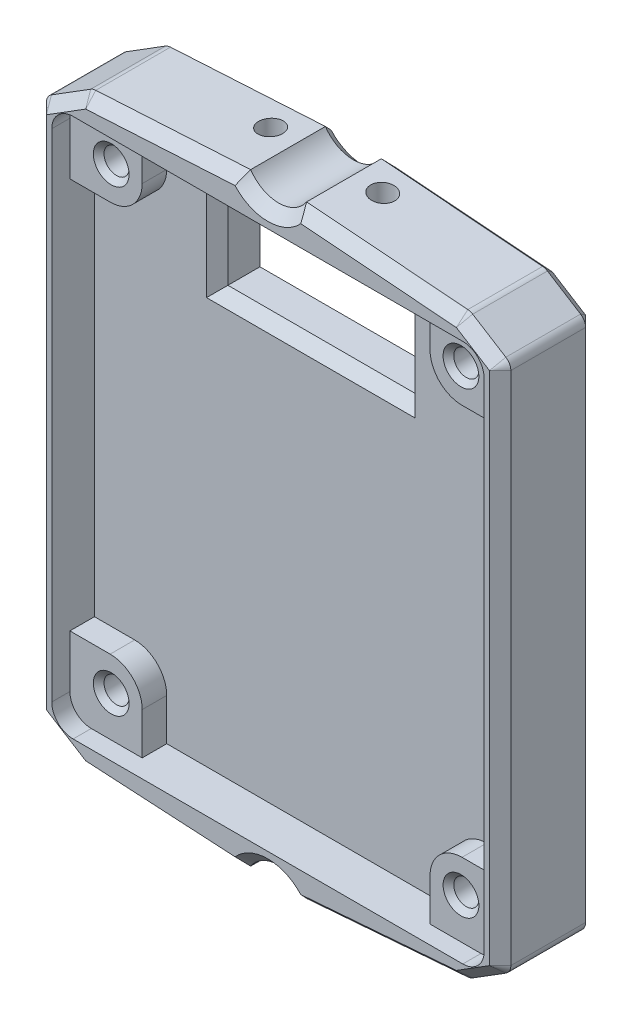
from build123d import *
from OCP.BRepFilletAPI import BRepFilletAPI_MakeChamfer

# Parameters (mm, degrees)
SKETCH1_W           = 46.5
SKETCH1_H           = 56.5
SKETCH1_W_2         = 40.5
SKETCH1_H_2         = 50.5
BOSS_EXTRUDE1_DEPTH = 4
SKETCH2_W           = 46.5
SKETCH2_H           = 56.5
BOSS_EXTRUDE2_DEPTH = 5
SKETCH3_W           = 6.769354508
SKETCH3_H           = 6.917814105
SKETCH3_R           = 1.175
BOSS_EXTRUDE3_DEPTH = 2.3
CHAMFER3_SIZE       = 4.5
CHAMFER3_SIZE2      = 7.201505381
FILLET1_R           = 3
SKETCH4_W           = 17.5
SKETCH4_H           = 10
CUT_EXTRUDE1_DEPTH  = 37.927293429
CUT_EXTRUDE2_DEPTH  = 38.677911301
SKETCH6_W           = 1.5
SKETCH6_H           = 60.377235873
CUT_EXTRUDE3_DEPTH  = 38.677911301
CUT_EXTRUDE4_START  = 30
SKETCH7_R           = 1.125
CUT_EXTRUDE4_DEPTH  = 10
FILLET2_R           = 1
CHAMFER1_SIZE       = 1
FILLET3_R           = 2
SKETCH8_R           = 1.175
CUT_EXTRUDE5_DEPTH  = 37.392706848
CUT_EXTRUDE6_DEPTH  = 1
CHAMFER2_SIZE       = 0.5
CHAMFER4_SIZE       = 1


# Some blends are built 0.0001 mm under size
with BuildPart() as part:
    # Sketch1 → Boss-Extrude1 (new body)
    with BuildSketch(Plane.XY):
        Rectangle(SKETCH1_W, SKETCH1_H)
        Rectangle(SKETCH1_W_2, SKETCH1_H_2, mode=Mode.SUBTRACT)
    extrude(amount=BOSS_EXTRUDE1_DEPTH)

    # Sketch2 → Boss-Extrude2 (add)
    with BuildSketch(Plane(origin=(0, 0, 0), x_dir=(-1, 0, 0), z_dir=(0, 0, -1))):
        Rectangle(SKETCH2_W, SKETCH2_H)
    extrude(amount=BOSS_EXTRUDE2_DEPTH)

    # Sketch3 → Boss-Extrude3 (add)
    # profile 1 of 4: a face of its own
    with BuildSketch(Plane.XY):
        with Locations((-16.865322746, 21.791092948)):
            Rectangle(SKETCH3_W, SKETCH3_H)
        with Locations((-16.38, 21.46)):
            Circle(SKETCH3_R, mode=Mode.SUBTRACT)
    # profile 2 of 4: a face of its own
    with BuildSketch(Plane.XY):
        with Locations((16.865322746, 21.791092948)):
            Rectangle(SKETCH3_W, SKETCH3_H)
        with Locations(Location((16.38, 21.46, 0), (0, 0, 180))):
            Circle(SKETCH3_R, mode=Mode.SUBTRACT)
    # profile 3 of 4: a face of its own
    with BuildSketch(Plane.XY):
        with Locations((16.865322746, -21.791092948)):
            Rectangle(SKETCH3_W, SKETCH3_H)
        with Locations((16.38, -21.46)):
            Circle(SKETCH3_R, mode=Mode.SUBTRACT)
    # profile 4 of 4: a face of its own
    with BuildSketch(Plane.XY):
        with Locations((-16.865322746, -21.791092948)):
            Rectangle(SKETCH3_W, SKETCH3_H)
        with Locations(Location((-16.38, -21.46, 0), (0, 0, 180))):
            Circle(SKETCH3_R, mode=Mode.SUBTRACT)
    extrude(amount=BOSS_EXTRUDE3_DEPTH)

    # Chamfer3: one chamfer whose edges measure the first distance from different faces: ONE call of the kernel's chamfer builder (chamfer() names one face for all edges)
    chamfer3_edges_1 = [part.edges().sort_by_distance(p)[0] for p in [
        (23.25, 28.25, -0.5),
        (23.25, -28.25, -0.5),
    ]]
    chamfer3_side_1 = [part.faces().sort_by_distance(p)[0] for p in [
        (23.25, 0, -0.5),
    ]]
    chamfer3_edges_2 = [part.edges().sort_by_distance(p)[0] for p in [
        (-23.25, -28.25, -0.5),
        (-23.25, 28.25, -0.5),
    ]]
    chamfer3_side_2 = [part.faces().sort_by_distance(p)[0] for p in [
        (-23.25, 0, -0.5),
    ]]
    chamfer3 = BRepFilletAPI_MakeChamfer(part.part.solid().wrapped)
    for e in chamfer3_edges_1:
        chamfer3.Add(CHAMFER3_SIZE, CHAMFER3_SIZE2, e.wrapped, chamfer3_side_1[0].wrapped)  # the first distance lies on this face
    for e in chamfer3_edges_2:
        chamfer3.Add(CHAMFER3_SIZE, CHAMFER3_SIZE2, e.wrapped, chamfer3_side_2[0].wrapped)  # the first distance lies on this face
    add(Compound.cast(chamfer3.Shape()), mode=Mode.REPLACE)

    # Fillet1
    fillet1_edges = [part.edges().sort_by_distance(p)[0] for p in [
        (-13.480645492, 18.332185895, 1.15),
        (13.480645492, 18.332185895, 1.15),
        (13.480645492, -18.332185895, 1.15),
        (-13.480645492, -18.332185895, 1.15),
    ]]
    fillet(fillet1_edges, radius=FILLET1_R)

    # Sketch4 → Cut-Extrude1 (cut, through all)
    with BuildSketch(Plane.XY):
        with Locations((0, 18.8)):
            Rectangle(SKETCH4_W, SKETCH4_H)
    extrude(amount=-CUT_EXTRUDE1_DEPTH, mode=Mode.SUBTRACT)

    # Sketch5 → Cut-Extrude2 (cut, through all)
    with BuildSketch(Plane(origin=(0, 0, -5), x_dir=(-1, 0, 0), z_dir=(0, 0, -1))):
        Polygon((-23.25, -26.637996363), (-23.25, -28.25), (-16.048494619, -28.25), (-17.967727773, -27.050730023), align=None)
        with BuildLine():
            ThreePointArc((2.619160171, -28.25), (0, -26.85), (-2.619160171, -28.25))
            Line((-2.619160171, -28.25), (2.619160171, -28.25))
        make_face()
        Polygon((17.383051154, -27.416076523), (16.048494619, -28.25), (23.25, -28.25), (23.25, -27.08468784), align=None)
        Polygon((-17.967727773, -27.050730023), (-16.048494619, -28.25), (-2.619160171, -28.25), align=None)
        Polygon((17.383051154, -27.416076523), (2.619160171, -28.25), (16.048494619, -28.25), align=None)
        Polygon((-17.967727773, 27.050730023), (-2.619160171, 28.25), (-16.048494619, 28.25), align=None)
        Polygon((16.048494619, 28.25), (2.619160171, 28.25), (17.383051154, 27.416076523), align=None)
        Polygon((16.048494619, 28.25), (17.383051154, 27.416076523), (23.25, 27.08468784), (23.25, 28.25), align=None)
        Polygon((-23.25, 26.637996363), (-17.967727773, 27.050730023), (-16.048494619, 28.25), (-23.25, 28.25), align=None)
        with BuildLine():
            Line((2.619160171, 28.25), (-2.619160171, 28.25))
            ThreePointArc((-2.619160171, 28.25), (0, 26.85), (2.619160171, 28.25))
        make_face()
    extrude(amount=-CUT_EXTRUDE2_DEPTH, mode=Mode.SUBTRACT)

    # Sketch6 → Cut-Extrude3 (cut, through all)
    with BuildSketch(Plane.XY.offset(4)):
        with Locations((-22.500324405, 3.019222435)):
            Rectangle(SKETCH6_W, SKETCH6_H)
        with Locations((22.500324405, 3.019222435)):
            Rectangle(SKETCH6_W, SKETCH6_H)
    extrude(amount=-CUT_EXTRUDE3_DEPTH, mode=Mode.SUBTRACT)

    # Sketch7 → Cut-Extrude4 (cut)
    with BuildSketch(Plane(origin=(0, 0, 0), x_dir=(1, 0, 0), z_dir=(0, 1, 0)).offset(CUT_EXTRUDE4_START)):
        with Locations((-5.25, 1.5)):
            Circle(SKETCH7_R)
        with Locations(Location((5.25, 1.5, 0), (0, 0, 180))):
            Circle(SKETCH7_R)
    cut_extrude4 = extrude(amount=-CUT_EXTRUDE4_DEPTH, mode=Mode.SUBTRACT)

    # Mirror1: Cut-Extrude4 across plane
    add(cut_extrude4.mirror(Plane.ZX), mode=Mode.SUBTRACT)

    # Fillet2
    fillet2_edges = [part.edges().sort_by_distance(p)[0] for p in [
        (-17.383051154, -27.416076523, -0.5),
        (17.967727773, -27.050730023, -0.5),
        (17.967727773, 27.050730023, -0.5),
        (-17.383051154, 27.416076523, -0.5),
        (21.750324405, 24.687101317, -0.5),
        (-21.750324405, -24.687101317, -0.5),
        (-21.750324405, 24.687101317, -0.5),
        (21.750324405, -24.687101317, -0.5),
    ]]
    fillet(fillet2_edges, radius=FILLET2_R)

    # Chamfer1
    # the kernel refuses this chamfer: 1 mm, written as the material it takes off along each edge
    with BuildSketch(Plane(origin=(-8.75, 13.8, -5), x_dir=(-1, 0, 0), z_dir=(0, 1, 0)), Plane(origin=(8.75, 23.8, -5), x_dir=(1, 0, 0), z_dir=(0, -1, 0))) as chamfer1_piece_1:
        Polygon((CHAMFER1_SIZE, 0), (0, CHAMFER1_SIZE), (0, 0), align=None)
    extrude(amount=10, mode=Mode.SUBTRACT)
    with BuildSketch(Plane(origin=(-8.75, 23.8, -5), x_dir=(0, 1, 0), z_dir=(1, 0, 0)), Plane(origin=(8.75, 13.8, -5), x_dir=(0, -1, 0), z_dir=(-1, 0, 0))) as chamfer1_piece_2:
        Polygon((CHAMFER1_SIZE, 0), (0, CHAMFER1_SIZE), (0, 0), align=None)
    extrude(amount=17.5, mode=Mode.SUBTRACT)
    with BuildSketch(Plane(origin=(-8.75, 13.8, 0), x_dir=(-1, 0, 0), z_dir=(0, 1, 0)), Plane(origin=(8.75, 23.8, 0), x_dir=(1, 0, 0), z_dir=(0, -1, 0))) as chamfer1_piece_3:
        Polygon((CHAMFER1_SIZE, 0), (0, -CHAMFER1_SIZE), (0, 0), align=None)
    extrude(amount=10, mode=Mode.SUBTRACT)
    with BuildSketch(Plane(origin=(8.75, 13.8, 0), x_dir=(0, -1, 0), z_dir=(-1, 0, 0)), Plane(origin=(-8.75, 23.8, 0), x_dir=(0, 1, 0), z_dir=(1, 0, 0))) as chamfer1_piece_4:
        Polygon((CHAMFER1_SIZE, 0), (0, -CHAMFER1_SIZE), (0, 0), align=None)
    extrude(amount=17.5, mode=Mode.SUBTRACT)
    with BuildSketch(Plane(origin=(0, -30, -5), x_dir=(-0.9741455172104229, -0.2259214715312333, 0), z_dir=(0.2259214715312333, -0.9741455172104229, 0))) as chamfer1_piece_5:
        Polygon((3.15, -CHAMFER1_SIZE), (3.15 + CHAMFER1_SIZE, 0), (3.15, 0), align=None)
    revolve(axis=Axis((0, -30, -5), (0, 0, -1)), revolution_arc=206.11413982, mode=Mode.SUBTRACT)
    with BuildSketch(Plane(origin=(0, -30, 4), x_dir=(-0.9741455172104229, -0.22592147153123326, 0), z_dir=(0.22592147153123326, -0.9741455172104229, 0))) as chamfer1_piece_6:
        Polygon((3.15 + CHAMFER1_SIZE, 0), (3.15, CHAMFER1_SIZE), (3.15, 0), align=None)
    revolve(axis=Axis((0, -30, 4), (0, 0, -1)), revolution_arc=206.11413982, mode=Mode.SUBTRACT)
    with BuildSketch(Plane(origin=(0, 30, 4), x_dir=(0.9741455172104218, 0.22592147153123757, 0), z_dir=(-0.22592147153123757, 0.9741455172104218, 0))) as chamfer1_piece_7:
        Polygon((3.15 + CHAMFER1_SIZE, 0), (3.15, CHAMFER1_SIZE), (3.15, 0), align=None)
    revolve(axis=Axis((0, 30, 4), (0, 0, -1)), revolution_arc=206.11413982, mode=Mode.SUBTRACT)
    with BuildSketch(Plane(origin=(0, 30, -5), x_dir=(0.9741455172104218, 0.22592147153123757, 0), z_dir=(-0.22592147153123757, 0.9741455172104218, 0))) as chamfer1_piece_8:
        Polygon((3.15, -CHAMFER1_SIZE), (3.15 + CHAMFER1_SIZE, 0), (3.15, 0), align=None)
    revolve(axis=Axis((0, 30, -5), (0, 0, -1)), revolution_arc=206.11413982, mode=Mode.SUBTRACT)
    with BuildSketch(Plane(origin=(-21.280243669, 24.980840362, 4), x_dir=(0.5299192642332031, -0.8480480961564273, 0), z_dir=(0.8480480961564273, 0.529919264233203, 0)), Plane(origin=(-21.280243669, 24.980840362, -5), x_dir=(0, 0, 1), z_dir=(0.8480480961564273, 0.529919264233203, 0))) as chamfer1_piece_9:
        Polygon((CHAMFER1_SIZE, 0), (0, CHAMFER1_SIZE), (0, 0), align=None)
    extrude(amount=4.339034518, mode=Mode.SUBTRACT)
    with BuildSketch(Plane(origin=(-21.750324405, 24.132792266, -5), x_dir=(0, 0, 1), z_dir=(0, -1, 0)), Plane(origin=(-21.750324405, 24.132792266, 4), x_dir=(1, 0, 0), z_dir=(0, -1, 0))) as chamfer1_piece_10:
        Polygon((CHAMFER1_SIZE, 0), (0, -CHAMFER1_SIZE), (0, 0), align=None)
    extrude(amount=48.265584531, mode=Mode.SUBTRACT)
    with BuildSketch(Plane(origin=(-17.127008544, 27.430538831, -5), x_dir=(0, 0, 1), z_dir=(0.9984085863848239, 0.056394101048406226, 0)), Plane(origin=(-0.051569794, -28.39502775, -5), x_dir=(0, 0, 1), z_dir=(-0.9984085863848239, 0.05639410104840627, 0)), Plane(origin=(-17.127008544, 27.430538831, 4), x_dir=(0.056394101048406406, -0.9984085863848238, 0), z_dir=(0.9984085863848238, 0.05639410104840641, 0)), Plane(origin=(-0.051569794, -28.39502775, 4), x_dir=(0.05639410104840633, 0.9984085863848238, 0), z_dir=(-0.9984085863848238, 0.05639410104840633, 0))) as chamfer1_piece_11:
        Polygon((CHAMFER1_SIZE, 0), (0, CHAMFER1_SIZE), (0, 0), align=None)
    extrude(amount=17.10265615, mode=Mode.SUBTRACT)
    with BuildSketch(Plane(origin=(0.055291708, 28.450329474, -5), x_dir=(0, 0, 1), z_dir=(0.9969613184840543, -0.07789819925091962, 0)), Plane(origin=(17.723475622, -27.069814818, -5), x_dir=(0, 0, 1), z_dir=(-0.9969613184840543, -0.07789819925091962, 0)), Plane(origin=(17.723475622, -27.069814818, 4), x_dir=(-0.07789819925091984, 0.9969613184840543, 0), z_dir=(-0.9969613184840543, -0.07789819925091984, 0)), Plane(origin=(0.055291708, 28.450329474, 4), x_dir=(-0.07789819925091988, -0.9969613184840543, 0), z_dir=(0.9969613184840543, -0.0778981992509199, 0))) as chamfer1_piece_12:
        Polygon((CHAMFER1_SIZE, 0), (0, CHAMFER1_SIZE), (0, 0), align=None)
    extrude(amount=17.722035536, mode=Mode.SUBTRACT)
    with BuildSketch(Plane(origin=(21.280243669, 24.980840362, -5), x_dir=(0, 0, 1), z_dir=(-0.8480480961564272, 0.529919264233203, 0)), Plane(origin=(21.280243669, 24.980840362, 4), x_dir=(-0.529919264233203, -0.8480480961564272, 0), z_dir=(-0.8480480961564272, 0.529919264233203, 0))) as chamfer1_piece_13:
        Polygon((CHAMFER1_SIZE, 0), (0, -CHAMFER1_SIZE), (0, 0), align=None)
    extrude(amount=3.661050589, mode=Mode.SUBTRACT)
    with BuildSketch(Plane(origin=(21.750324405, 24.132792266, -5), x_dir=(0, 0, 1), z_dir=(0, -1, 0)), Plane(origin=(21.750324405, 24.132792266, 4), x_dir=(-1, 0, 0), z_dir=(0, -1, 0))) as chamfer1_piece_14:
        Polygon((CHAMFER1_SIZE, 0), (0, CHAMFER1_SIZE), (0, 0), align=None)
    extrude(amount=48.265584531, mode=Mode.SUBTRACT)
    with BuildSketch(Plane(origin=(21.280243669, -24.980840362, -5), x_dir=(0, 0, 1), z_dir=(-0.8480480961564274, -0.5299192642332029, 0)), Plane(origin=(21.280243669, -24.980840362, 4), x_dir=(-0.5299192642332028, 0.8480480961564273, 0), z_dir=(-0.8480480961564274, -0.5299192642332029, 0))) as chamfer1_piece_15:
        Polygon((CHAMFER1_SIZE, 0), (0, CHAMFER1_SIZE), (0, 0), align=None)
    extrude(amount=3.661050589, mode=Mode.SUBTRACT)
    with BuildSketch(Plane(origin=(-21.280243669, -24.980840362, -5), x_dir=(0, 0, 1), z_dir=(0.8480480961564274, -0.5299192642332028, 0)), Plane(origin=(-21.280243669, -24.980840362, 4), x_dir=(0.5299192642332029, 0.8480480961564274, 0), z_dir=(0.8480480961564274, -0.5299192642332028, 0))) as chamfer1_piece_16:
        Polygon((CHAMFER1_SIZE, 0), (0, -CHAMFER1_SIZE), (0, 0), align=None)
    extrude(amount=4.339034518, mode=Mode.SUBTRACT)
    with BuildSketch(Plane(origin=(20.750324405, 24.132792266, -5), x_dir=(0.5299192642332002, 0.848048096156429, 0), z_dir=(-0.848048096156429, 0.5299192642332002, 0))) as chamfer1_piece_17:
        Polygon((1, -CHAMFER1_SIZE), (1 - CHAMFER1_SIZE, 0), (1, 0), align=None)
    revolve(axis=Axis((20.750324405, 24.132792266, -5), (0, 0, -1)), revolution_arc=58, mode=Mode.SUBTRACT)
    with BuildSketch(Plane(origin=(-20.750324405, 24.132792266, -5), x_dir=(-0.5299192642332002, 0.848048096156429, 0), z_dir=(0.848048096156429, 0.5299192642332002, 0))) as chamfer1_piece_18:
        Polygon((1, CHAMFER1_SIZE), (1 - CHAMFER1_SIZE, 0), (1, 0), align=None)
    revolve(axis=Axis((-20.750324405, 24.132792266, -5), (0, 0, 1)), revolution_arc=58, mode=Mode.SUBTRACT)
    with BuildSketch(Plane(origin=(-20.750324405, -24.132792266, -5), x_dir=(-0.5299192642332002, -0.848048096156429, 0), z_dir=(0.848048096156429, -0.5299192642332002, 0))) as chamfer1_piece_19:
        Polygon((1, -CHAMFER1_SIZE), (1 - CHAMFER1_SIZE, 0), (1, 0), align=None)
    revolve(axis=Axis((-20.750324405, -24.132792266, -5), (0, 0, -1)), revolution_arc=58, mode=Mode.SUBTRACT)
    with BuildSketch(Plane(origin=(-17.070614443, -26.432130245, -5), x_dir=(-0.05639410104840442, -0.9984085863848239, 0), z_dir=(0.9984085863848239, -0.05639410104840442, 0))) as chamfer1_piece_20:
        Polygon((1, -CHAMFER1_SIZE), (1 - CHAMFER1_SIZE, 0), (1, 0), align=None)
    revolve(axis=Axis((-17.070614443, -26.432130245, -5), (0, 0, -1)), revolution_arc=28.7671409, mode=Mode.SUBTRACT)
    with BuildSketch(Plane(origin=(17.645577423, -26.0728535, -5), x_dir=(0.5299192642332029, -0.8480480961564274, 0), z_dir=(0.8480480961564274, 0.5299192642332029, 0))) as chamfer1_piece_21:
        Polygon((1, -CHAMFER1_SIZE), (1 - CHAMFER1_SIZE, 0), (1, 0), align=None)
    revolve(axis=Axis((17.645577423, -26.0728535, -5), (0, 0, -1)), revolution_arc=27.532235663, mode=Mode.SUBTRACT)
    with BuildSketch(Plane(origin=(20.750324405, -24.132792266, -5), x_dir=(1, 0, 0), z_dir=(0, 1, 0))) as chamfer1_piece_22:
        Polygon((1, -CHAMFER1_SIZE), (1 - CHAMFER1_SIZE, 0), (1, 0), align=None)
    revolve(axis=Axis((20.750324405, -24.132792266, -5), (0, 0, -1)), revolution_arc=58, mode=Mode.SUBTRACT)
    with BuildSketch(Plane(origin=(17.645577423, 26.0728535, -5), x_dir=(0.07789819925092091, 0.9969613184840542, 0), z_dir=(-0.9969613184840542, 0.07789819925092091, 0))) as chamfer1_piece_23:
        Polygon((1, -CHAMFER1_SIZE), (1 - CHAMFER1_SIZE, 0), (1, 0), align=None)
    revolve(axis=Axis((17.645577423, 26.0728535, -5), (0, 0, -1)), revolution_arc=27.532235663, mode=Mode.SUBTRACT)
    with BuildSketch(Plane(origin=(-17.070614443, 26.432130245, -5), x_dir=(-0.5299192642332029, 0.8480480961564274, 0), z_dir=(-0.8480480961564274, -0.5299192642332029, 0))) as chamfer1_piece_24:
        Polygon((1, -CHAMFER1_SIZE), (1 - CHAMFER1_SIZE, 0), (1, 0), align=None)
    revolve(axis=Axis((-17.070614443, 26.432130245, -5), (0, 0, -1)), revolution_arc=28.7671409, mode=Mode.SUBTRACT)
    with BuildSketch(Plane(origin=(20.750324405, 24.132792266, 4), x_dir=(0.5299192642332002, 0.848048096156429, 0), z_dir=(-0.848048096156429, 0.5299192642332002, 0))) as chamfer1_piece_25:
        Polygon((1 - CHAMFER1_SIZE, 0), (1, CHAMFER1_SIZE), (1, 0), align=None)
    revolve(axis=Axis((20.750324405, 24.132792266, 4), (0, 0, -1)), revolution_arc=58, mode=Mode.SUBTRACT)
    with BuildSketch(Plane(origin=(-20.750324405, 24.132792266, 4), x_dir=(-0.5299192642332002, 0.848048096156429, 0), z_dir=(0.848048096156429, 0.5299192642332002, 0))) as chamfer1_piece_26:
        Polygon((1 - CHAMFER1_SIZE, 0), (1, -CHAMFER1_SIZE), (1, 0), align=None)
    revolve(axis=Axis((-20.750324405, 24.132792266, 4), (0, 0, 1)), revolution_arc=58, mode=Mode.SUBTRACT)
    with BuildSketch(Plane(origin=(-20.750324405, -24.132792266, 4), x_dir=(-0.5299192642332029, -0.8480480961564274, 0), z_dir=(0.8480480961564274, -0.5299192642332029, 0))) as chamfer1_piece_27:
        Polygon((1 - CHAMFER1_SIZE, 0), (1, CHAMFER1_SIZE), (1, 0), align=None)
    revolve(axis=Axis((-20.750324405, -24.132792266, 4), (0, 0, -1)), revolution_arc=58, mode=Mode.SUBTRACT)
    with BuildSketch(Plane(origin=(-17.070614443, -26.432130245, 4), x_dir=(-0.05639410104840797, -0.9984085863848238, 0), z_dir=(0.9984085863848238, -0.05639410104840797, 0))) as chamfer1_piece_28:
        Polygon((1 - CHAMFER1_SIZE, 0), (1, CHAMFER1_SIZE), (1, 0), align=None)
    revolve(axis=Axis((-17.070614443, -26.432130245, 4), (0, 0, -1)), revolution_arc=28.7671409, mode=Mode.SUBTRACT)
    with BuildSketch(Plane(origin=(17.645577423, -26.0728535, 4), x_dir=(0.5299192642332029, -0.8480480961564274, 0), z_dir=(0.8480480961564274, 0.5299192642332029, 0))) as chamfer1_piece_29:
        Polygon((1 - CHAMFER1_SIZE, 0), (1, CHAMFER1_SIZE), (1, 0), align=None)
    revolve(axis=Axis((17.645577423, -26.0728535, 4), (0, 0, -1)), revolution_arc=27.532235663, mode=Mode.SUBTRACT)
    with BuildSketch(Plane(origin=(20.750324405, -24.132792266, 4), x_dir=(1, 0, 0), z_dir=(0, 1, 0))) as chamfer1_piece_30:
        Polygon((1 - CHAMFER1_SIZE, 0), (1, CHAMFER1_SIZE), (1, 0), align=None)
    revolve(axis=Axis((20.750324405, -24.132792266, 4), (0, 0, -1)), revolution_arc=58, mode=Mode.SUBTRACT)
    with BuildSketch(Plane(origin=(17.645577423, 26.0728535, 4), x_dir=(0.07789819925092091, 0.9969613184840542, 0), z_dir=(-0.9969613184840542, 0.07789819925092091, 0))) as chamfer1_piece_31:
        Polygon((1 - CHAMFER1_SIZE, 0), (1, CHAMFER1_SIZE), (1, 0), align=None)
    revolve(axis=Axis((17.645577423, 26.0728535, 4), (0, 0, -1)), revolution_arc=27.532235663, mode=Mode.SUBTRACT)
    with BuildSketch(Plane(origin=(-17.070614443, 26.432130245, 4), x_dir=(-0.5299192642332029, 0.8480480961564274, 0), z_dir=(-0.8480480961564274, -0.5299192642332029, 0))) as chamfer1_piece_32:
        Polygon((1 - CHAMFER1_SIZE, 0), (1, CHAMFER1_SIZE), (1, 0), align=None)
    revolve(axis=Axis((-17.070614443, 26.432130245, 4), (0, 0, -1)), revolution_arc=28.7671409, mode=Mode.SUBTRACT)
    with BuildSketch(Plane(origin=(-8.75, 11.228317012, -5), x_dir=(-1, 0, 0), z_dir=(0, 1, 0))) as chamfer1_piece_33a_section:
        Polygon((CHAMFER1_SIZE, 0), (0, CHAMFER1_SIZE), (0, 0), align=None)
    chamfer1_piece_33a = extrude(amount=12.571682988, mode=Mode.PRIVATE)
    chamfer1_piece_33a = split(chamfer1_piece_33a, bisect_by=Plane(origin=(-8.75, 13.8, -5), z_dir=(0, -1, 0)), keep=Keep.TOP, mode=Mode.PRIVATE)
    with BuildSketch(Plane(origin=(8.75, 13.8, -5), x_dir=(0, -1, 0), z_dir=(-1, 0, 0))) as chamfer1_piece_33b_section:
        Polygon((CHAMFER1_SIZE, 0), (0, CHAMFER1_SIZE), (0, 0), align=None)
    chamfer1_piece_33b = extrude(amount=20.071682988, mode=Mode.PRIVATE)
    chamfer1_piece_33b = split(chamfer1_piece_33b, bisect_by=Plane(origin=(-8.75, 13.8, -5), z_dir=(-1, 0, 0)), keep=Keep.TOP, mode=Mode.PRIVATE)
    chamfer1_piece_33 = chamfer1_piece_33a & chamfer1_piece_33b
    add(chamfer1_piece_33, mode=Mode.SUBTRACT)
    with BuildSketch(Plane(origin=(-8.75, 13.8, -5), x_dir=(-1, 0, 0), z_dir=(0, 1, 0))) as chamfer1_piece_34a_section:
        Polygon((CHAMFER1_SIZE, 0), (0, CHAMFER1_SIZE), (0, 0), align=None)
    chamfer1_piece_34a = extrude(amount=12.571682988, mode=Mode.PRIVATE)
    chamfer1_piece_34a = split(chamfer1_piece_34a, bisect_by=Plane(origin=(-8.75, 23.8, -5), z_dir=(0, 1, 0)), keep=Keep.TOP, mode=Mode.PRIVATE)
    with BuildSketch(Plane(origin=(-11.321682988, 23.8, -5), x_dir=(0, 1, 0), z_dir=(1, 0, 0))) as chamfer1_piece_34b_section:
        Polygon((CHAMFER1_SIZE, 0), (0, CHAMFER1_SIZE), (0, 0), align=None)
    chamfer1_piece_34b = extrude(amount=20.071682988, mode=Mode.PRIVATE)
    chamfer1_piece_34b = split(chamfer1_piece_34b, bisect_by=Plane(origin=(-8.75, 23.8, -5), z_dir=(-1, 0, 0)), keep=Keep.TOP, mode=Mode.PRIVATE)
    chamfer1_piece_34 = chamfer1_piece_34a & chamfer1_piece_34b
    add(chamfer1_piece_34, mode=Mode.SUBTRACT)
    with BuildSketch(Plane(origin=(-8.75, 23.8, -5), x_dir=(0, 1, 0), z_dir=(1, 0, 0))) as chamfer1_piece_35a_section:
        Polygon((CHAMFER1_SIZE, 0), (0, CHAMFER1_SIZE), (0, 0), align=None)
    chamfer1_piece_35a = extrude(amount=20.071682988, mode=Mode.PRIVATE)
    chamfer1_piece_35a = split(chamfer1_piece_35a, bisect_by=Plane(origin=(8.75, 23.8, -5), z_dir=(1, 0, 0)), keep=Keep.TOP, mode=Mode.PRIVATE)
    with BuildSketch(Plane(origin=(8.75, 26.371682988, -5), x_dir=(1, 0, 0), z_dir=(0, -1, 0))) as chamfer1_piece_35b_section:
        Polygon((CHAMFER1_SIZE, 0), (0, CHAMFER1_SIZE), (0, 0), align=None)
    chamfer1_piece_35b = extrude(amount=12.571682988, mode=Mode.PRIVATE)
    chamfer1_piece_35b = split(chamfer1_piece_35b, bisect_by=Plane(origin=(8.75, 23.8, -5), z_dir=(0, 1, 0)), keep=Keep.TOP, mode=Mode.PRIVATE)
    chamfer1_piece_35 = chamfer1_piece_35a & chamfer1_piece_35b
    add(chamfer1_piece_35, mode=Mode.SUBTRACT)
    with BuildSketch(Plane(origin=(11.321682988, 13.8, -5), x_dir=(0, -1, 0), z_dir=(-1, 0, 0))) as chamfer1_piece_36a_section:
        Polygon((CHAMFER1_SIZE, 0), (0, CHAMFER1_SIZE), (0, 0), align=None)
    chamfer1_piece_36a = extrude(amount=20.071682988, mode=Mode.PRIVATE)
    chamfer1_piece_36a = split(chamfer1_piece_36a, bisect_by=Plane(origin=(8.75, 13.8, -5), z_dir=(1, 0, 0)), keep=Keep.TOP, mode=Mode.PRIVATE)
    with BuildSketch(Plane(origin=(8.75, 23.8, -5), x_dir=(1, 0, 0), z_dir=(0, -1, 0))) as chamfer1_piece_36b_section:
        Polygon((CHAMFER1_SIZE, 0), (0, CHAMFER1_SIZE), (0, 0), align=None)
    chamfer1_piece_36b = extrude(amount=12.571682988, mode=Mode.PRIVATE)
    chamfer1_piece_36b = split(chamfer1_piece_36b, bisect_by=Plane(origin=(8.75, 13.8, -5), z_dir=(0, -1, 0)), keep=Keep.TOP, mode=Mode.PRIVATE)
    chamfer1_piece_36 = chamfer1_piece_36a & chamfer1_piece_36b
    add(chamfer1_piece_36, mode=Mode.SUBTRACT)
    with BuildSketch(Plane(origin=(-8.75, 11.228317012, 0), x_dir=(-1, 0, 0), z_dir=(0, 1, 0))) as chamfer1_piece_37a_section:
        Polygon((CHAMFER1_SIZE, 0), (0, -CHAMFER1_SIZE), (0, 0), align=None)
    chamfer1_piece_37a = extrude(amount=12.571682988, mode=Mode.PRIVATE)
    chamfer1_piece_37a = split(chamfer1_piece_37a, bisect_by=Plane(origin=(-8.75, 13.8, 0), z_dir=(0, -1, 0)), keep=Keep.TOP, mode=Mode.PRIVATE)
    with BuildSketch(Plane(origin=(8.75, 13.8, 0), x_dir=(0, -1, 0), z_dir=(-1, 0, 0))) as chamfer1_piece_37b_section:
        Polygon((CHAMFER1_SIZE, 0), (0, -CHAMFER1_SIZE), (0, 0), align=None)
    chamfer1_piece_37b = extrude(amount=20.071682988, mode=Mode.PRIVATE)
    chamfer1_piece_37b = split(chamfer1_piece_37b, bisect_by=Plane(origin=(-8.75, 13.8, 0), z_dir=(-1, 0, 0)), keep=Keep.TOP, mode=Mode.PRIVATE)
    chamfer1_piece_37 = chamfer1_piece_37a & chamfer1_piece_37b
    add(chamfer1_piece_37, mode=Mode.SUBTRACT)
    with BuildSketch(Plane(origin=(-8.75, 13.8, 0), x_dir=(-1, 0, 0), z_dir=(0, 1, 0))) as chamfer1_piece_38a_section:
        Polygon((CHAMFER1_SIZE, 0), (0, -CHAMFER1_SIZE), (0, 0), align=None)
    chamfer1_piece_38a = extrude(amount=12.571682988, mode=Mode.PRIVATE)
    chamfer1_piece_38a = split(chamfer1_piece_38a, bisect_by=Plane(origin=(-8.75, 25.25, 0), z_dir=(0, -1, 0)), keep=Keep.TOP, mode=Mode.PRIVATE)
    chamfer1_piece_38a = split(chamfer1_piece_38a, bisect_by=Plane(origin=(-8.75, 23.8, 0), z_dir=(0, 1, 0)), keep=Keep.TOP, mode=Mode.PRIVATE)
    with BuildSketch(Plane(origin=(-11.321682988, 23.8, 0), x_dir=(0, 1, 0), z_dir=(1, 0, 0))) as chamfer1_piece_38b_section:
        Polygon((CHAMFER1_SIZE, 0), (0, -CHAMFER1_SIZE), (0, 0), align=None)
    chamfer1_piece_38b = extrude(amount=20.071682988, mode=Mode.PRIVATE)
    chamfer1_piece_38b = split(chamfer1_piece_38b, bisect_by=Plane(origin=(-8.75, 23.8, 0), z_dir=(-1, 0, 0)), keep=Keep.TOP, mode=Mode.PRIVATE)
    chamfer1_piece_38 = chamfer1_piece_38a & chamfer1_piece_38b
    add(chamfer1_piece_38, mode=Mode.SUBTRACT)
    with BuildSketch(Plane(origin=(11.321682988, 13.8, 0), x_dir=(0, -1, 0), z_dir=(-1, 0, 0))) as chamfer1_piece_39a_section:
        Polygon((CHAMFER1_SIZE, 0), (0, -CHAMFER1_SIZE), (0, 0), align=None)
    chamfer1_piece_39a = extrude(amount=20.071682988, mode=Mode.PRIVATE)
    chamfer1_piece_39a = split(chamfer1_piece_39a, bisect_by=Plane(origin=(8.75, 13.8, 0), z_dir=(1, 0, 0)), keep=Keep.TOP, mode=Mode.PRIVATE)
    with BuildSketch(Plane(origin=(8.75, 23.8, 0), x_dir=(1, 0, 0), z_dir=(0, -1, 0))) as chamfer1_piece_39b_section:
        Polygon((CHAMFER1_SIZE, 0), (0, -CHAMFER1_SIZE), (0, 0), align=None)
    chamfer1_piece_39b = extrude(amount=12.571682988, mode=Mode.PRIVATE)
    chamfer1_piece_39b = split(chamfer1_piece_39b, bisect_by=Plane(origin=(8.75, 13.8, 0), z_dir=(0, -1, 0)), keep=Keep.TOP, mode=Mode.PRIVATE)
    chamfer1_piece_39 = chamfer1_piece_39a & chamfer1_piece_39b
    add(chamfer1_piece_39, mode=Mode.SUBTRACT)
    with BuildSketch(Plane(origin=(8.75, 26.371682988, 0), x_dir=(1, 0, 0), z_dir=(0, -1, 0))) as chamfer1_piece_40a_section:
        Polygon((CHAMFER1_SIZE, 0), (0, -CHAMFER1_SIZE), (0, 0), align=None)
    chamfer1_piece_40a = extrude(amount=12.571682988, mode=Mode.PRIVATE)
    chamfer1_piece_40a = split(chamfer1_piece_40a, bisect_by=Plane(origin=(8.75, 25.25, 0), z_dir=(0, -1, 0)), keep=Keep.TOP, mode=Mode.PRIVATE)
    chamfer1_piece_40a = split(chamfer1_piece_40a, bisect_by=Plane(origin=(8.75, 23.8, 0), z_dir=(0, 1, 0)), keep=Keep.TOP, mode=Mode.PRIVATE)
    with BuildSketch(Plane(origin=(-8.75, 23.8, 0), x_dir=(0, 1, 0), z_dir=(1, 0, 0))) as chamfer1_piece_40b_section:
        Polygon((CHAMFER1_SIZE, 0), (0, -CHAMFER1_SIZE), (0, 0), align=None)
    chamfer1_piece_40b = extrude(amount=20.071682988, mode=Mode.PRIVATE)
    chamfer1_piece_40b = split(chamfer1_piece_40b, bisect_by=Plane(origin=(8.75, 23.8, 0), z_dir=(1, 0, 0)), keep=Keep.TOP, mode=Mode.PRIVATE)
    chamfer1_piece_40 = chamfer1_piece_40a & chamfer1_piece_40b
    add(chamfer1_piece_40, mode=Mode.SUBTRACT)

    # Fillet3
    # the kernel refuses this fillet: 2 mm, written as the material it adds along each edge
    with BuildSketch(Plane(origin=(-20.25, -25.25, -2.7), x_dir=(1, 0, 0), z_dir=(0, 0, 1))) as fillet3_piece_1_section:
        with BuildLine():
            CenterArc((FILLET3_R, FILLET3_R), FILLET3_R, 180, 90)
            Line((0, FILLET3_R), (0, 0))
            Line((0, 0), (FILLET3_R, 0))
        make_face()
    fillet3_piece_1 = extrude(amount=11.017685648, mode=Mode.PRIVATE)
    fillet3_piece_1 = split(fillet3_piece_1, bisect_by=Plane(origin=(-20.25, -25.25, 4), z_dir=(0, 0, -1)), keep=Keep.TOP, mode=Mode.PRIVATE)
    fillet3_piece_1 = split(fillet3_piece_1, bisect_by=Plane(origin=(-21.844443776, -27.801643429, 0.308842824), z_dir=(0.3747095052207162, 0.5996605595645308, -0.7071067811865475)), keep=Keep.TOP, mode=Mode.PRIVATE)
    add(fillet3_piece_1)
    with BuildSketch(Plane(origin=(20.25, -25.25, -2.7), x_dir=(0, 1, 0), z_dir=(0, 0, 1))) as fillet3_piece_2_section:
        with BuildLine():
            CenterArc((FILLET3_R, FILLET3_R), FILLET3_R, 180, 90)
            Line((0, FILLET3_R), (0, 0))
            Line((0, 0), (FILLET3_R, 0))
        make_face()
    fillet3_piece_2 = extrude(amount=11.017685648, mode=Mode.PRIVATE)
    fillet3_piece_2 = split(fillet3_piece_2, bisect_by=Plane(origin=(20.25, -25.25, 4), z_dir=(0, 0, -1)), keep=Keep.TOP, mode=Mode.PRIVATE)
    fillet3_piece_2 = split(fillet3_piece_2, bisect_by=Plane(origin=(21.844443776, -27.801643429, 0.308842824), z_dir=(-0.37470950522071644, 0.5996605595645308, -0.7071067811865477)), keep=Keep.TOP, mode=Mode.PRIVATE)
    add(fillet3_piece_2)
    with BuildSketch(Plane(origin=(20.25, 25.25, -2.7), x_dir=(0, -1, 0), z_dir=(0, 0, 1))) as fillet3_piece_3_section:
        with BuildLine():
            CenterArc((FILLET3_R, -FILLET3_R), FILLET3_R, 90, 90)
            Line((0, -FILLET3_R), (0, 0))
            Line((0, 0), (FILLET3_R, 0))
        make_face()
    fillet3_piece_3 = extrude(amount=11.017685648, mode=Mode.PRIVATE)
    fillet3_piece_3 = split(fillet3_piece_3, bisect_by=Plane(origin=(20.25, 25.25, 4), z_dir=(0, 0, -1)), keep=Keep.TOP, mode=Mode.PRIVATE)
    fillet3_piece_3 = split(fillet3_piece_3, bisect_by=Plane(origin=(21.844443776, 27.801643429, 0.308842824), z_dir=(-0.37470950522071644, -0.5996605595645308, -0.7071067811865477)), keep=Keep.TOP, mode=Mode.PRIVATE)
    add(fillet3_piece_3)
    with BuildSketch(Plane(origin=(-20.25, 25.25, -2.7), x_dir=(0, -1, 0), z_dir=(0, 0, 1))) as fillet3_piece_4_section:
        with BuildLine():
            CenterArc((FILLET3_R, FILLET3_R), FILLET3_R, 180, 90)
            Line((0, FILLET3_R), (0, 0))
            Line((0, 0), (FILLET3_R, 0))
        make_face()
    fillet3_piece_4 = extrude(amount=11.017685648, mode=Mode.PRIVATE)
    fillet3_piece_4 = split(fillet3_piece_4, bisect_by=Plane(origin=(-21.844443776, 27.801643429, 0.308842824), z_dir=(0.3747095052207162, -0.5996605595645308, -0.7071067811865475)), keep=Keep.TOP, mode=Mode.PRIVATE)
    fillet3_piece_4 = split(fillet3_piece_4, bisect_by=Plane(origin=(-20.25, 25.25, 4), z_dir=(0, 0, -1)), keep=Keep.TOP, mode=Mode.PRIVATE)
    add(fillet3_piece_4)

    # Sketch8 → Cut-Extrude5 (cut, through all)
    with BuildSketch(Plane.XY.offset(2.3)):
        with Locations((-16.38, 21.46)):
            Circle(SKETCH8_R)
        with Locations(Location((16.38, 21.46, 0), (0, 0, 180))):
            Circle(SKETCH8_R)
        with Locations((16.38, -21.46)):
            Circle(SKETCH8_R)
        with Locations(Location((-16.38, -21.46, 0), (0, 0, 180))):
            Circle(SKETCH8_R)
    extrude(amount=-CUT_EXTRUDE5_DEPTH, mode=Mode.SUBTRACT)

    # Sketch9 → Cut-Extrude6 (cut)
    with BuildSketch(Plane(origin=(0, 0, -5), x_dir=(-1, 0, 0), z_dir=(0, 0, -1))):
        with BuildLine():
            Line((-16.374158343, -2.036488248), (-6.384848004, -2.036488248))
            ThreePointArc((-6.384848004, -2.036488248), (-1.5, -2.786488248), (-6.384848004, -3.536488248))
            Line((-6.384848004, -3.536488248), (-12.618681454, -3.536488248))
            Line((-12.618681454, -3.536488248), (0, -15.530095236))
            Line((0, -15.530095236), (12.618681454, -3.536488248))
            Line((12.618681454, -3.536488248), (6.384848004, -3.536488248))
            ThreePointArc((6.384848004, -3.536488248), (1.5, -2.786488248), (6.384848004, -2.036488248))
            Line((6.384848004, -2.036488248), (16.374158343, -2.036488248))
            Line((16.374158343, -2.036488248), (0, -17.599542173))
            Line((0, -17.599542173), (-16.374158343, -2.036488248))
        make_face()
    extrude(amount=-CUT_EXTRUDE6_DEPTH, mode=Mode.SUBTRACT)

    # Chamfer2
    chamfer2_edges = [part.edges().sort_by_distance(p)[0] for p in [
        (-17.555, 21.46, 2.3),
        (17.555, 21.46, 2.3),
        (15.205, -21.46, 2.3),
        (-15.205, -21.46, 2.3),
    ]]
    chamfer(chamfer2_edges, length=CHAMFER2_SIZE)

    # Chamfer4
    chamfer4_edges = [part.edges().sort_by_distance(p)[0] for p in [
        (-8.187079171, -9.81801521, -5),
        (-11.379503173, -2.036488248, -5),
        (-1.5, -2.786488248, -5),
        (-9.501764729, -3.536488248, -5),
        (-6.309340727, -9.533291742, -5),
        (6.309340727, -9.533291742, -5),
        (9.501764729, -3.536488248, -5),
        (1.5, -2.786488248, -5),
        (11.379503173, -2.036488248, -5),
        (8.187079171, -9.81801521, -5),
    ]]
    chamfer(chamfer4_edges, length=CHAMFER4_SIZE - 0.0001)  # a hair under: the kernel refuses the full size


solid = part.part
